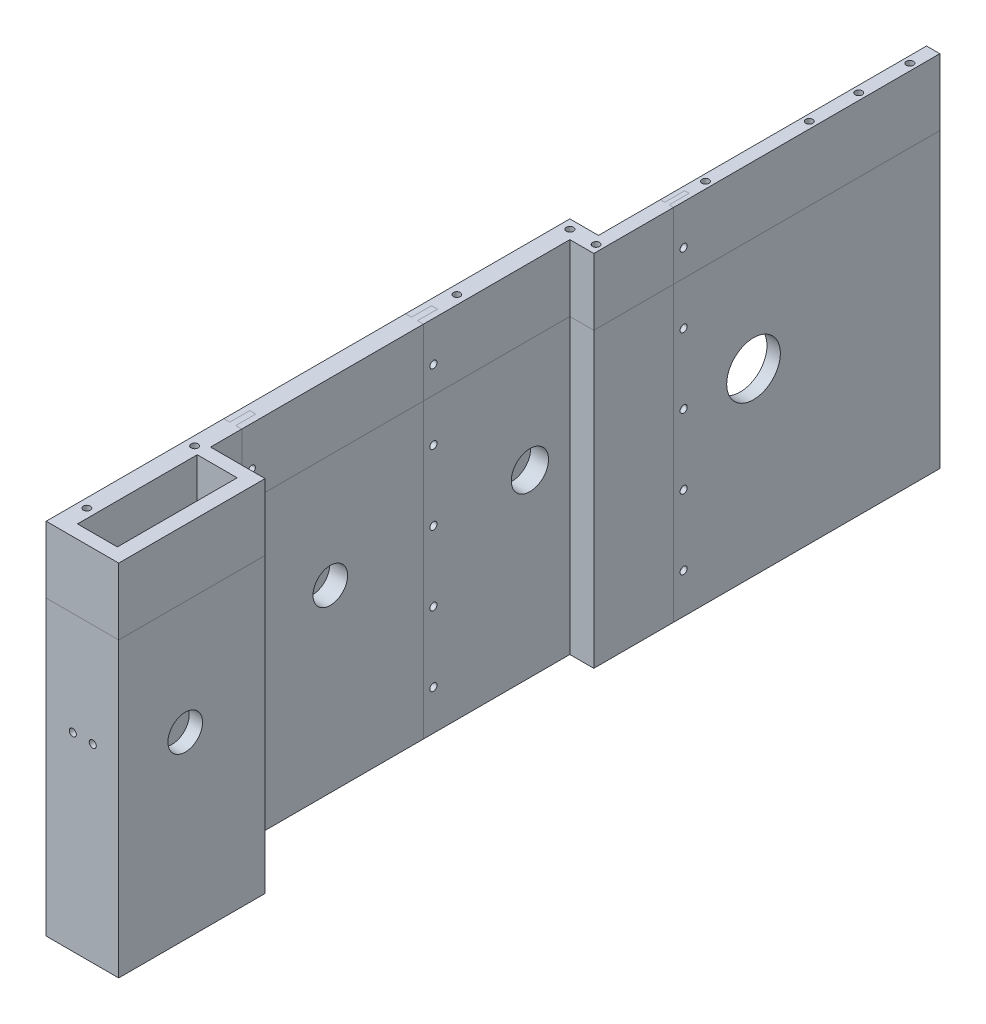
from build123d import *

# Parameters (mm, degrees)
SKETCH1_W               = 640
SKETCH1_H               = 270
SKETCH1_R               = 13
SKETCH1_R_2             = 14
SKETCH1_R_3             = 20.15
BOSS_EXTRUDE1_DEPTH     = 10
SKETCH2_W               = 440
SKETCH2_H               = 270
SKETCH2_R               = 14
SKETCH2_R_2             = 13
BOSS_EXTRUDE2_DEPTH     = 20
SKETCH3_W               = 430
SKETCH3_H               = 270
SKETCH3_R               = 5
SKETCH3_R_2             = 6
CUT_EXTRUDE1_DEPTH      = 20
SKETCH4_W               = 110
SKETCH4_H               = 270
SKETCH4_R               = 5
BOSS_EXTRUDE3_DEPTH     = 40
SKETCH6_W               = 100
SKETCH6_H               = 270
SKETCH6_R               = 5
CUT_EXTRUDE2_DEPTH      = 40
CUT_EXTRUDE3_DEPTH      = 351.89172119
CUT_EXTRUDE3_DEPTH_BACK = 351.89172119
SKETCH10_R              = 13
SKETCH11_W              = 40
SKETCH11_H              = 100
BOSS_EXTRUDE4_DEPTH     = 270
CUT_EXTRUDE4_DEPTH      = 420.761837236
CUT_EXTRUDE4_DEPTH_BACK = 420.761837236
SKETCH12_W              = 30
SKETCH12_H              = 90
SKETCH13_R              = 15
BOSS_EXTRUDE5_DEPTH     = 31
BOSS_EXTRUDE6_START     = 1
SKETCH15_W              = 110
SKETCH15_H              = 270
SKETCH15_R              = 13
BOSS_EXTRUDE6_DEPTH     = 1
SKETCH16_W              = 120
SKETCH16_H              = 270
SKETCH16_R              = 14
SKETCH16_W_2            = 320
SKETCH16_R_2            = 13
BOSS_EXTRUDE7_DEPTH     = 3.5
SKETCH17_W              = 200
SKETCH17_H              = 270
SKETCH17_R              = 20.15
BOSS_EXTRUDE8_DEPTH     = 2
SKETCH18_W              = 20
SKETCH18_H              = 270
BOSS_EXTRUDE9_DEPTH     = 5
BOSS_EXTRUDE10_DEPTH    = 270
CUT_EXTRUDE5_DEPTH      = 421.02648726
CUT_EXTRUDE5_DEPTH_BACK = 421.02648726
SKETCH20_W              = 2
SKETCH20_H              = 215
SKETCH20_W_2            = 21.5
SKETCH20_H_2            = 46.5
CUT_EXTRUDE7_DEPTH      = 349.73664849
CUT_EXTRUDE7_DEPTH_BACK = 349.73664849
SKETCH22_R              = 2.7
SPLIT5_START            = -33.5
SPLIT5_OUTLINE_W        = 270
SPLIT5_OUTLINE_H        = 121.51543622
SPLIT5_OUTLINE_R        = 13
SPLIT5_DEPTH            = 13.5
SPLIT5_2_OUTLINE_W      = 270
SPLIT5_2_OUTLINE_H      = 15
SPLIT5_2_OUTLINE_R      = 2.7
SPLIT5_2_DEPTH          = 4.5
SPLIT5_START_2          = -29
SPLIT5_3_OUTLINE_W      = 270
SPLIT5_3_OUTLINE_H      = 15
SPLIT5_3_OUTLINE_R      = 2.7
SPLIT5_3_DEPTH          = 4.5
SPLIT5_START_3          = -24.5
SPLIT5_4_OUTLINE_W      = 270
SPLIT5_4_OUTLINE_H      = 15
SPLIT5_4_OUTLINE_R      = 2.7
SPLIT5_4_DEPTH          = 4.5
SPLIT5_5_OUTLINE_W      = 270
SPLIT5_5_OUTLINE_H      = 108.5
SPLIT5_5_OUTLINE_R      = 14
SPLIT5_5_DEPTH          = 13.5
SPLIT5_START_4          = -12
SPLIT5_6_OUTLINE_W      = 270
SPLIT5_6_OUTLINE_H      = 60
SPLIT5_6_DEPTH          = 10
SPLIT5_START_5          = -20
SPLIT5_7_OUTLINE_W      = 270
SPLIT5_7_OUTLINE_H      = 13.5
SPLIT5_7_DEPTH          = 8
SPLIT5_8_OUTLINE_W      = 270
SPLIT5_8_OUTLINE_H      = 15
SPLIT5_8_OUTLINE_R      = 2.7
SPLIT5_8_DEPTH          = 4.5
SPLIT5_9_OUTLINE_W      = 270
SPLIT5_9_OUTLINE_H      = 15
SPLIT5_9_OUTLINE_R      = 2.7
SPLIT5_9_DEPTH          = 4.5
SPLIT5_START_6          = -8.67
SPLIT5_10_OUTLINE_W     = 270
SPLIT5_10_OUTLINE_H     = 15
SPLIT5_10_OUTLINE_R     = 2.7
SPLIT5_10_DEPTH         = 3.34
SPLIT5_11_OUTLINE_W     = 270
SPLIT5_11_OUTLINE_H     = 491.51543622
SPLIT5_11_OUTLINE_R     = 2.7
SPLIT5_11_OUTLINE_R_2   = 14
SPLIT5_11_OUTLINE_R_3   = 13
SPLIT5_11_OUTLINE_R_4   = 20.15
SPLIT5_11_DEPTH         = 31.5
SPLIT5_12_OUTLINE_W     = 270
SPLIT5_12_OUTLINE_H     = 15
SPLIT5_12_OUTLINE_R     = 2.7
SPLIT5_12_DEPTH         = 4.5
SPLIT5_13_OUTLINE_W     = 270
SPLIT5_13_OUTLINE_H     = 15
SPLIT5_13_OUTLINE_R     = 2.7
SPLIT5_13_DEPTH         = 4.5
SPLIT5_14_OUTLINE_W     = 270
SPLIT5_14_OUTLINE_H     = 185
SPLIT5_14_OUTLINE_R     = 20.15
SPLIT5_14_DEPTH         = 10
SPLIT5_15_OUTLINE_W     = 270
SPLIT5_15_OUTLINE_H     = 15
SPLIT5_15_OUTLINE_R     = 2.7
SPLIT5_15_DEPTH         = 3.33
SPLIT5_START_7          = -5.33
SPLIT5_16_OUTLINE_W     = 270
SPLIT5_16_OUTLINE_H     = 15
SPLIT5_16_OUTLINE_R     = 2.7
SPLIT5_16_DEPTH         = 3.33
CUT_EXTRUDE8_DEPTH      = 421.02648726
CUT_EXTRUDE8_DEPTH_BACK = 100
SKETCH28_R              = 2.65
SPLIT6_START            = 85
SPLIT6_OUTLINE_R        = 2.65
SPLIT6_DEPTH            = 50
SPLIT6_2_OUTLINE_R      = 2.65
SPLIT6_2_OUTLINE_W      = 30
SPLIT6_2_OUTLINE_H      = 90
SPLIT6_2_DEPTH          = 50
SPLIT6_START_2          = -30
SPLIT6_3_OUTLINE_R      = 2.7
SPLIT6_3_DEPTH          = 6
SPLIT6_4_DEPTH          = 50
SPLIT6_5_OUTLINE_R      = 2.65
SPLIT6_5_DEPTH          = 50
SPLIT6_START_3          = -33.5
SPLIT6_6_OUTLINE_W      = 50
SPLIT6_6_OUTLINE_H      = 121.51543622
SPLIT6_6_DEPTH          = 13.5
SPLIT6_7_OUTLINE_W      = 50
SPLIT6_7_OUTLINE_H      = 15
SPLIT6_7_OUTLINE_R      = 2.7
SPLIT6_7_DEPTH          = 4.5
SPLIT6_START_4          = -29
SPLIT6_8_OUTLINE_W      = 50
SPLIT6_8_OUTLINE_H      = 15
SPLIT6_8_OUTLINE_R      = 2.7
SPLIT6_8_DEPTH          = 4.5
SPLIT6_START_5          = -24.5
SPLIT6_9_OUTLINE_W      = 50
SPLIT6_9_OUTLINE_H      = 15
SPLIT6_9_OUTLINE_R      = 2.7
SPLIT6_9_DEPTH          = 4.5
SPLIT6_10_OUTLINE_W     = 50
SPLIT6_10_OUTLINE_H     = 108.5
SPLIT6_10_DEPTH         = 13.5
SPLIT6_START_6          = -12
SPLIT6_11_OUTLINE_W     = 50
SPLIT6_11_OUTLINE_H     = 60
SPLIT6_11_DEPTH         = 10
SPLIT6_START_7          = -20
SPLIT6_12_OUTLINE_W     = 50
SPLIT6_12_OUTLINE_H     = 13.5
SPLIT6_12_DEPTH         = 8
SPLIT6_13_OUTLINE_W     = 50
SPLIT6_13_OUTLINE_H     = 15
SPLIT6_13_OUTLINE_R     = 2.7
SPLIT6_13_DEPTH         = 4.5
SPLIT6_14_OUTLINE_W     = 50
SPLIT6_14_OUTLINE_H     = 15
SPLIT6_14_OUTLINE_R     = 2.7
SPLIT6_14_DEPTH         = 4.5
SPLIT6_START_8          = -8.67
SPLIT6_15_OUTLINE_W     = 50
SPLIT6_15_OUTLINE_H     = 15
SPLIT6_15_OUTLINE_R     = 2.7
SPLIT6_15_DEPTH         = 3.34
SPLIT6_START_9          = 84
SPLIT6_16_OUTLINE_R     = 2.65
SPLIT6_16_DEPTH         = 52
SPLIT6_17_OUTLINE_R     = 2.65
SPLIT6_17_OUTLINE_W     = 30
SPLIT6_17_OUTLINE_H     = 90
SPLIT6_17_DEPTH         = 50
SPLIT6_18_OUTLINE_R     = 2.65
SPLIT6_18_DEPTH         = 50
SPLIT6_START_10         = -13
SPLIT6_19_OUTLINE_R     = 2.7
SPLIT6_19_DEPTH         = 12
SKETCH31_R              = 2.65
CUT_EXTRUDE9_DEPTH      = 20
SKETCH34_R              = 27.5
BOSS_EXTRUDE14_DEPTH    = 10
SKETCH35_R              = 25
BOSS_EXTRUDE15_DEPTH    = 10


with BuildPart() as part:
    # Sketch1 → Boss-Extrude1 (new body)
    with BuildSketch(Plane(origin=(0, 0, 0), x_dir=(0, 0, -1), z_dir=(1, 0, 0))):
        Rectangle(SKETCH1_W, SKETCH1_H)
        with Locations((-270, 0)):
            Circle(SKETCH1_R, mode=Mode.SUBTRACT)
        with Locations((-120, 0)):
            Circle(SKETCH1_R, mode=Mode.SUBTRACT)
        with Locations((30, 0)):
            Circle(SKETCH1_R_2, mode=Mode.SUBTRACT)
        with Locations((180, 0)):
            Circle(SKETCH1_R_3, mode=Mode.SUBTRACT)
    extrude(amount=-BOSS_EXTRUDE1_DEPTH)

    # Sketch2 → Boss-Extrude2 (add)
    with BuildSketch(Plane.ZY.offset(10)):
        with Locations((100, 0)):
            Rectangle(SKETCH2_W, SKETCH2_H)
        with Locations(Location((-30, 0, 0), (0, 0, 180))):
            Circle(SKETCH2_R, mode=Mode.SUBTRACT)
        with Locations(Location((120, 0, 0), (0, 0, 180))):
            Circle(SKETCH2_R_2, mode=Mode.SUBTRACT)
        with Locations(Location((270, 0, 0), (0, 0, 180))):
            Circle(SKETCH2_R_2, mode=Mode.SUBTRACT)
    extrude(amount=BOSS_EXTRUDE2_DEPTH)

    # Sketch3 → Cut-Extrude1 (cut)
    with BuildSketch(Plane(origin=(0, 0, 0), x_dir=(0, 0, -1), z_dir=(1, 0, 0))):
        with Locations((-105, 0)):
            Rectangle(SKETCH3_W, SKETCH3_H)
        with Locations((-270, 0)):
            Circle(SKETCH3_R, mode=Mode.SUBTRACT)
        with Locations((-120, 0)):
            Circle(SKETCH3_R, mode=Mode.SUBTRACT)
        with Locations((30, 0)):
            Circle(SKETCH3_R_2, mode=Mode.SUBTRACT)
    extrude(amount=-CUT_EXTRUDE1_DEPTH, mode=Mode.SUBTRACT)

    # Sketch4 → Boss-Extrude3 (add)
    with BuildSketch(Plane(origin=(-20, 0, 0), x_dir=(0, 0, -1), z_dir=(1, 0, 0))):
        with Locations((-265, 0)):
            Rectangle(SKETCH4_W, SKETCH4_H)
        with Locations((-270, 0)):
            Circle(SKETCH4_R, mode=Mode.SUBTRACT)
    extrude(amount=BOSS_EXTRUDE3_DEPTH)

    # Sketch6 → Cut-Extrude2 (cut)
    with BuildSketch(Plane.ZY.offset(30)):
        with Locations((270, 0)):
            Rectangle(SKETCH6_W, SKETCH6_H)
        with Locations((270, 0)):
            Circle(SKETCH6_R, mode=Mode.SUBTRACT)
    extrude(amount=-CUT_EXTRUDE2_DEPTH, mode=Mode.SUBTRACT)


with BuildPart() as body_2:
    # Split2: read off the stored shape, not the designer's step
    # Split2: the piece on the far side of the plane
    add(part.part)
    split(bisect_by=Plane.XY, keep=Keep.BOTTOM)


with BuildPart() as part_1:
    add(part.part)

    # Split2
    split(bisect_by=Plane.XY, keep=Keep.TOP)

    # Sketch10 → Cut-Extrude3 (cut, two sides: drawn at the far end of the back side and taken through both)
    with BuildSketch(Plane(origin=(20, 0, 0), x_dir=(0, 0, -1), z_dir=(1, 0, 0)).offset(-CUT_EXTRUDE3_DEPTH_BACK)):
        with Locations((-270, 0)):
            Circle(SKETCH10_R)
    extrude(amount=CUT_EXTRUDE3_DEPTH + CUT_EXTRUDE3_DEPTH_BACK, mode=Mode.SUBTRACT)

    # Sketch11 → Boss-Extrude4 (add)
    with BuildSketch(Plane(origin=(0, 135, 0), x_dir=(1, 0, 0), z_dir=(0, 1, 0))):
        with Locations((-10, -270)):
            Rectangle(SKETCH11_W, SKETCH11_H)
    extrude(amount=-BOSS_EXTRUDE4_DEPTH)

    # Sketch12 → Cut-Extrude4 (cut, two sides: drawn at the far end of the back side and taken through both)
    with BuildSketch(Plane(origin=(0, 135, 0), x_dir=(1, 0, 0), z_dir=(0, 1, 0)).offset(-CUT_EXTRUDE4_DEPTH_BACK)):
        with Locations((-5, -265)):
            Rectangle(SKETCH12_W, SKETCH12_H)
    extrude(amount=CUT_EXTRUDE4_DEPTH + CUT_EXTRUDE4_DEPTH_BACK, mode=Mode.SUBTRACT)

    # Sketch13 → Boss-Extrude5 (add)
    with BuildSketch(Plane(origin=(-20, 0, 0), x_dir=(0, 0, -1), z_dir=(1, 0, 0))):
        with Locations(Location((-270, 0, 0), (0, 0, 180))):
            Circle(SKETCH13_R)
    extrude(amount=BOSS_EXTRUDE5_DEPTH)

    # Sketch15 → Boss-Extrude6 (add)
    with BuildSketch(Plane(origin=(20, 0, 0), x_dir=(0, 0, -1), z_dir=(1, 0, 0)).offset(BOSS_EXTRUDE6_START)):
        with Locations((-265, 0)):
            Rectangle(SKETCH15_W, SKETCH15_H)
        with Locations((-270, 0)):
            Circle(SKETCH15_R, mode=Mode.SUBTRACT)
    extrude(amount=-BOSS_EXTRUDE6_DEPTH)

    add(body_2.part)  # Boss-Extrude7 merges body 2
    # Sketch16 → Boss-Extrude7 (add)
    # profile 1 of 2: a face of its own
    with BuildSketch(Plane.ZY.offset(30)):
        with Locations((-60, 0)):
            Rectangle(SKETCH16_W, SKETCH16_H)
        with Locations(Location((-30, 0, 0), (0, 0, 180))):
            Circle(SKETCH16_R, mode=Mode.SUBTRACT)
    # profile 2 of 2: a face of its own
    with BuildSketch(Plane.ZY.offset(30)):
        with Locations((160, 0)):
            Rectangle(SKETCH16_W_2, SKETCH16_H)
        with Locations(Location((120, 0, 0), (0, 0, 180))):
            Circle(SKETCH16_R_2, mode=Mode.SUBTRACT)
    extrude(amount=BOSS_EXTRUDE7_DEPTH)

    # Sketch17 → Boss-Extrude8 (add)
    with BuildSketch(Plane.ZY.offset(10)):
        with Locations((-220, 0)):
            Rectangle(SKETCH17_W, SKETCH17_H)
        with Locations(Location((-180, 0, 0), (0, 0, 180))):
            Circle(SKETCH17_R, mode=Mode.SUBTRACT)
    extrude(amount=BOSS_EXTRUDE8_DEPTH)

    # Sketch18 → Boss-Extrude9 (add)
    with BuildSketch(Plane.XY.offset(-110)):
        with Locations((-10, 0)):
            Rectangle(SKETCH18_W, SKETCH18_H)
    extrude(amount=BOSS_EXTRUDE9_DEPTH)

    # Sketch19 → Boss-Extrude10 (add)
    with BuildSketch(Plane(origin=(0, 135, 0), x_dir=(1, 0, 0), z_dir=(0, 1, 0))):
        Polygon((-12, 73.5), (-33.5, 73.5), (-33.5, 60), (-2, 60), (-2, 120), (-12, 120), align=None)
    extrude(amount=-BOSS_EXTRUDE10_DEPTH)

    # Sketch20 → Cut-Extrude5 (cut, two sides: drawn at the far end of the back side and taken through both)
    with BuildSketch(Plane(origin=(0, 135, 0), x_dir=(1, 0, 0), z_dir=(0, 1, 0)).offset(-CUT_EXTRUDE5_DEPTH_BACK)):
        with Locations((-1, 212.5)):
            Rectangle(SKETCH20_W, SKETCH20_H)
        with Locations((-22.75, 96.75)):
            Rectangle(SKETCH20_W_2, SKETCH20_H_2)
    extrude(amount=CUT_EXTRUDE5_DEPTH + CUT_EXTRUDE5_DEPTH_BACK, mode=Mode.SUBTRACT)

    # Sketch22 → Cut-Extrude7 (cut, two sides: drawn at the far end of the back side and taken through both)
    with BuildSketch(Plane(origin=(-2, 0, 0), x_dir=(0, 0, -1), z_dir=(1, 0, 0)).offset(-CUT_EXTRUDE7_DEPTH_BACK)):
        with Locations((127.5, 105)):
            Circle(SKETCH22_R)
        with Locations((127.5, 52.5)):
            Circle(SKETCH22_R)
        with Locations((127.5, 0)):
            Circle(SKETCH22_R)
        with Locations((127.5, -52.5)):
            Circle(SKETCH22_R)
        with Locations((127.5, -105)):
            Circle(SKETCH22_R)
        with Locations((-42.5, -105)):
            Circle(SKETCH22_R)
        with Locations((-42.5, -52.5)):
            Circle(SKETCH22_R)
        with Locations((-42.5, 0)):
            Circle(SKETCH22_R)
        with Locations((-42.5, 52.5)):
            Circle(SKETCH22_R)
        with Locations((-42.5, 105)):
            Circle(SKETCH22_R)
        with Locations((-179.01543622, -105)):
            Circle(SKETCH22_R)
        with Locations((-179.01543622, -52.5)):
            Circle(SKETCH22_R)
        with Locations((-179.01543622, 0)):
            Circle(SKETCH22_R)
        with Locations((-179.01543622, 52.5)):
            Circle(SKETCH22_R)
        with Locations((-179.01543622, 105)):
            Circle(SKETCH22_R)
    extrude(amount=CUT_EXTRUDE7_DEPTH + CUT_EXTRUDE7_DEPTH_BACK, mode=Mode.SUBTRACT)

    # Split5 11 outline → Split5 11 (cut)
    with BuildSketch(Plane.YZ.offset(SPLIT5_START)):
        with Locations((0, -74.24228189)):
            Rectangle(SPLIT5_11_OUTLINE_W, SPLIT5_11_OUTLINE_H)
        with Locations((-105, 42.5)):
            Circle(SPLIT5_11_OUTLINE_R, mode=Mode.SUBTRACT)
        with Locations((-52.5, 42.5)):
            Circle(SPLIT5_11_OUTLINE_R, mode=Mode.SUBTRACT)
        with Locations((0, -30)):
            Circle(SPLIT5_11_OUTLINE_R_2, mode=Mode.SUBTRACT)
        with Locations((0, 42.5)):
            Circle(SPLIT5_11_OUTLINE_R, mode=Mode.SUBTRACT)
        with Locations((52.5, 42.5)):
            Circle(SPLIT5_11_OUTLINE_R, mode=Mode.SUBTRACT)
        with Locations((105, 42.5)):
            Circle(SPLIT5_11_OUTLINE_R, mode=Mode.SUBTRACT)
        with Locations((0, 120)):
            Circle(SPLIT5_11_OUTLINE_R_3, mode=Mode.SUBTRACT)
        with Locations((105, -127.5)):
            Circle(SPLIT5_11_OUTLINE_R, mode=Mode.SUBTRACT)
        with Locations((-105, -127.5)):
            Circle(SPLIT5_11_OUTLINE_R, mode=Mode.SUBTRACT)
        with Locations((-52.5, -127.5)):
            Circle(SPLIT5_11_OUTLINE_R, mode=Mode.SUBTRACT)
        with Locations((0, -180)):
            Circle(SPLIT5_11_OUTLINE_R_4, mode=Mode.SUBTRACT)
        with Locations((0, -127.5)):
            Circle(SPLIT5_11_OUTLINE_R, mode=Mode.SUBTRACT)
        with Locations((52.5, -127.5)):
            Circle(SPLIT5_11_OUTLINE_R, mode=Mode.SUBTRACT)
    extrude(amount=SPLIT5_11_DEPTH, mode=Mode.SUBTRACT)

    # Split5 12 outline → Split5 12 (cut)
    with BuildSketch(Plane.YZ.offset(SPLIT5_START)):
        with Locations((0, 179.01543622)):
            Rectangle(SPLIT5_12_OUTLINE_W, SPLIT5_12_OUTLINE_H)
        with Locations((-105, 179.01543622)):
            Circle(SPLIT5_12_OUTLINE_R, mode=Mode.SUBTRACT)
        with Locations((-52.5, 179.01543622)):
            Circle(SPLIT5_12_OUTLINE_R, mode=Mode.SUBTRACT)
        with Locations((0, 179.01543622)):
            Circle(SPLIT5_12_OUTLINE_R, mode=Mode.SUBTRACT)
        with Locations((52.5, 179.01543622)):
            Circle(SPLIT5_12_OUTLINE_R, mode=Mode.SUBTRACT)
        with Locations((105, 179.01543622)):
            Circle(SPLIT5_12_OUTLINE_R, mode=Mode.SUBTRACT)
    extrude(amount=SPLIT5_12_DEPTH, mode=Mode.SUBTRACT)

    # Split5 13 outline → Split5 13 (cut)
    with BuildSketch(Plane.YZ.offset(SPLIT5_START_3)):
        with Locations((0, 179.01543622)):
            Rectangle(SPLIT5_13_OUTLINE_W, SPLIT5_13_OUTLINE_H)
        with Locations((-105, 179.01543622)):
            Circle(SPLIT5_13_OUTLINE_R, mode=Mode.SUBTRACT)
        with Locations((-52.5, 179.01543622)):
            Circle(SPLIT5_13_OUTLINE_R, mode=Mode.SUBTRACT)
        with Locations((0, 179.01543622)):
            Circle(SPLIT5_13_OUTLINE_R, mode=Mode.SUBTRACT)
        with Locations((52.5, 179.01543622)):
            Circle(SPLIT5_13_OUTLINE_R, mode=Mode.SUBTRACT)
        with Locations((105, 179.01543622)):
            Circle(SPLIT5_13_OUTLINE_R, mode=Mode.SUBTRACT)
    extrude(amount=SPLIT5_13_DEPTH, mode=Mode.SUBTRACT)


with BuildPart() as body_2_2:
    # Split5: read off the stored shape, not the designer's step
    # Split5 outline → Split5 (new body)
    with BuildSketch(Plane.YZ.offset(SPLIT5_START)):
        with Locations((0, 110.75771811)):
            Rectangle(SPLIT5_OUTLINE_W, SPLIT5_OUTLINE_H)
        with Locations((0, 120)):
            Circle(SPLIT5_OUTLINE_R, mode=Mode.SUBTRACT)
    extrude(amount=SPLIT5_DEPTH)

    # Split5 2 outline → Split5 2 (add)
    with BuildSketch(Plane.YZ.offset(SPLIT5_START)):
        with Locations((0, 179.01543622)):
            Rectangle(SPLIT5_2_OUTLINE_W, SPLIT5_2_OUTLINE_H)
        with Locations((-105, 179.01543622)):
            Circle(SPLIT5_2_OUTLINE_R, mode=Mode.SUBTRACT)
        with Locations((-52.5, 179.01543622)):
            Circle(SPLIT5_2_OUTLINE_R, mode=Mode.SUBTRACT)
        with Locations((0, 179.01543622)):
            Circle(SPLIT5_2_OUTLINE_R, mode=Mode.SUBTRACT)
        with Locations((52.5, 179.01543622)):
            Circle(SPLIT5_2_OUTLINE_R, mode=Mode.SUBTRACT)
        with Locations((105, 179.01543622)):
            Circle(SPLIT5_2_OUTLINE_R, mode=Mode.SUBTRACT)
    extrude(amount=SPLIT5_2_DEPTH)

    # Split5 3 outline → Split5 3 (add)
    with BuildSketch(Plane.YZ.offset(SPLIT5_START_2)):
        with Locations((0, 42.5)):
            Rectangle(SPLIT5_3_OUTLINE_W, SPLIT5_3_OUTLINE_H)
        with Locations((-105, 42.5)):
            Circle(SPLIT5_3_OUTLINE_R, mode=Mode.SUBTRACT)
        with Locations((-52.5, 42.5)):
            Circle(SPLIT5_3_OUTLINE_R, mode=Mode.SUBTRACT)
        with Locations((0, 42.5)):
            Circle(SPLIT5_3_OUTLINE_R, mode=Mode.SUBTRACT)
        with Locations((52.5, 42.5)):
            Circle(SPLIT5_3_OUTLINE_R, mode=Mode.SUBTRACT)
        with Locations((105, 42.5)):
            Circle(SPLIT5_3_OUTLINE_R, mode=Mode.SUBTRACT)
    extrude(amount=SPLIT5_3_DEPTH)

    # Split5 4 outline → Split5 4 (add)
    with BuildSketch(Plane.YZ.offset(SPLIT5_START_3)):
        with Locations((0, 179.01543622)):
            Rectangle(SPLIT5_4_OUTLINE_W, SPLIT5_4_OUTLINE_H)
        with Locations((-105, 179.01543622)):
            Circle(SPLIT5_4_OUTLINE_R, mode=Mode.SUBTRACT)
        with Locations((-52.5, 179.01543622)):
            Circle(SPLIT5_4_OUTLINE_R, mode=Mode.SUBTRACT)
        with Locations((0, 179.01543622)):
            Circle(SPLIT5_4_OUTLINE_R, mode=Mode.SUBTRACT)
        with Locations((52.5, 179.01543622)):
            Circle(SPLIT5_4_OUTLINE_R, mode=Mode.SUBTRACT)
        with Locations((105, 179.01543622)):
            Circle(SPLIT5_4_OUTLINE_R, mode=Mode.SUBTRACT)
    extrude(amount=SPLIT5_4_DEPTH)

    # Split6 4 outline → Split6 4 (cut)
    with BuildSketch(Plane(origin=(0, 0, 0), x_dir=(1, 0, 0), z_dir=(0, 1, 0)).offset(SPLIT6_START)):
        Polygon((-29, -35), (-29, -50), (-33.5, -50), (-33.5, -186.51543622), (-29, -186.51543622), (-29, -171.51543622), (-24.5, -171.51543622), (-24.5, -186.51543622), (-20, -186.51543622), (-20, -50), (-24.5, -50), (-24.5, -35), align=None)
    extrude(amount=SPLIT6_4_DEPTH, mode=Mode.SUBTRACT)

    # Sketch35 → Boss-Extrude15 (add)
    with BuildSketch(Plane.ZY.offset(33.5)):
        with Locations((120, 0)):
            Circle(SKETCH35_R)
    extrude(amount=BOSS_EXTRUDE15_DEPTH)


with BuildPart() as body_3:
    # Split5 5 outline → Split5 5 (new body)
    with BuildSketch(Plane.YZ.offset(SPLIT5_START)):
        with Locations((0, -19.25)):
            Rectangle(SPLIT5_5_OUTLINE_W, SPLIT5_5_OUTLINE_H)
        with Locations((0, -30)):
            Circle(SPLIT5_5_OUTLINE_R, mode=Mode.SUBTRACT)
    extrude(amount=SPLIT5_5_DEPTH)

    # Split5 6 outline → Split5 6 (add)
    with BuildSketch(Plane.YZ.offset(SPLIT5_START_4)):
        with Locations((0, -90)):
            Rectangle(SPLIT5_6_OUTLINE_W, SPLIT5_6_OUTLINE_H)
    extrude(amount=SPLIT5_6_DEPTH)

    # Split5 7 outline → Split5 7 (add)
    with BuildSketch(Plane.YZ.offset(SPLIT5_START_5)):
        with Locations((0, -66.75)):
            Rectangle(SPLIT5_7_OUTLINE_W, SPLIT5_7_OUTLINE_H)
    extrude(amount=SPLIT5_7_DEPTH)

    # Split5 8 outline → Split5 8 (add)
    with BuildSketch(Plane.YZ.offset(SPLIT5_START)):
        with Locations((0, 42.5)):
            Rectangle(SPLIT5_8_OUTLINE_W, SPLIT5_8_OUTLINE_H)
        with Locations((-105, 42.5)):
            Circle(SPLIT5_8_OUTLINE_R, mode=Mode.SUBTRACT)
        with Locations((-52.5, 42.5)):
            Circle(SPLIT5_8_OUTLINE_R, mode=Mode.SUBTRACT)
        with Locations((0, 42.5)):
            Circle(SPLIT5_8_OUTLINE_R, mode=Mode.SUBTRACT)
        with Locations((52.5, 42.5)):
            Circle(SPLIT5_8_OUTLINE_R, mode=Mode.SUBTRACT)
        with Locations((105, 42.5)):
            Circle(SPLIT5_8_OUTLINE_R, mode=Mode.SUBTRACT)
    extrude(amount=SPLIT5_8_DEPTH)

    # Split5 9 outline → Split5 9 (add)
    with BuildSketch(Plane.YZ.offset(SPLIT5_START_3)):
        with Locations((0, 42.5)):
            Rectangle(SPLIT5_9_OUTLINE_W, SPLIT5_9_OUTLINE_H)
        with Locations((-105, 42.5)):
            Circle(SPLIT5_9_OUTLINE_R, mode=Mode.SUBTRACT)
        with Locations((-52.5, 42.5)):
            Circle(SPLIT5_9_OUTLINE_R, mode=Mode.SUBTRACT)
        with Locations((0, 42.5)):
            Circle(SPLIT5_9_OUTLINE_R, mode=Mode.SUBTRACT)
        with Locations((52.5, 42.5)):
            Circle(SPLIT5_9_OUTLINE_R, mode=Mode.SUBTRACT)
        with Locations((105, 42.5)):
            Circle(SPLIT5_9_OUTLINE_R, mode=Mode.SUBTRACT)
    extrude(amount=SPLIT5_9_DEPTH)

    # Split5 10 outline → Split5 10 (add)
    with BuildSketch(Plane.YZ.offset(SPLIT5_START_6)):
        with Locations((0, -127.5)):
            Rectangle(SPLIT5_10_OUTLINE_W, SPLIT5_10_OUTLINE_H)
        with Locations((-105, -127.5)):
            Circle(SPLIT5_10_OUTLINE_R, mode=Mode.SUBTRACT)
        with Locations((-52.5, -127.5)):
            Circle(SPLIT5_10_OUTLINE_R, mode=Mode.SUBTRACT)
        with Locations((0, -127.5)):
            Circle(SPLIT5_10_OUTLINE_R, mode=Mode.SUBTRACT)
        with Locations((52.5, -127.5)):
            Circle(SPLIT5_10_OUTLINE_R, mode=Mode.SUBTRACT)
        with Locations((105, -127.5)):
            Circle(SPLIT5_10_OUTLINE_R, mode=Mode.SUBTRACT)
    extrude(amount=SPLIT5_10_DEPTH)


with BuildPart() as body_4:
    # Split5 14 outline → Split5 14 (new body)
    with BuildSketch(Plane.YZ.offset(SPLIT5_START_4)):
        with Locations((0, -227.5)):
            Rectangle(SPLIT5_14_OUTLINE_W, SPLIT5_14_OUTLINE_H)
        with Locations((0, -180)):
            Circle(SPLIT5_14_OUTLINE_R, mode=Mode.SUBTRACT)
    extrude(amount=SPLIT5_14_DEPTH)

    # Split5 15 outline → Split5 15 (add)
    with BuildSketch(Plane.YZ.offset(SPLIT5_START_4)):
        with Locations((0, -127.5)):
            Rectangle(SPLIT5_15_OUTLINE_W, SPLIT5_15_OUTLINE_H)
        with Locations((-105, -127.5)):
            Circle(SPLIT5_15_OUTLINE_R, mode=Mode.SUBTRACT)
        with Locations((-52.5, -127.5)):
            Circle(SPLIT5_15_OUTLINE_R, mode=Mode.SUBTRACT)
        with Locations((0, -127.5)):
            Circle(SPLIT5_15_OUTLINE_R, mode=Mode.SUBTRACT)
        with Locations((52.5, -127.5)):
            Circle(SPLIT5_15_OUTLINE_R, mode=Mode.SUBTRACT)
        with Locations((105, -127.5)):
            Circle(SPLIT5_15_OUTLINE_R, mode=Mode.SUBTRACT)
    extrude(amount=SPLIT5_15_DEPTH)

    # Split5 16 outline → Split5 16 (add)
    with BuildSketch(Plane.YZ.offset(SPLIT5_START_7)):
        with Locations((0, -127.5)):
            Rectangle(SPLIT5_16_OUTLINE_W, SPLIT5_16_OUTLINE_H)
        with Locations((-105, -127.5)):
            Circle(SPLIT5_16_OUTLINE_R, mode=Mode.SUBTRACT)
        with Locations((-52.5, -127.5)):
            Circle(SPLIT5_16_OUTLINE_R, mode=Mode.SUBTRACT)
        with Locations((0, -127.5)):
            Circle(SPLIT5_16_OUTLINE_R, mode=Mode.SUBTRACT)
        with Locations((52.5, -127.5)):
            Circle(SPLIT5_16_OUTLINE_R, mode=Mode.SUBTRACT)
        with Locations((105, -127.5)):
            Circle(SPLIT5_16_OUTLINE_R, mode=Mode.SUBTRACT)
    extrude(amount=SPLIT5_16_DEPTH)


with BuildPart() as cut_extrude8_tool:
    # Sketch28 → Cut-Extrude8 (new, two sides: drawn at the far end of the back side and taken through both)
    with BuildSketch(Plane(origin=(0, 135, 0), x_dir=(1, 0, 0), z_dir=(0, 1, 0)).offset(-CUT_EXTRUDE8_DEPTH_BACK)):
        with Locations(Location((-7, 264.039794869, 0), (0, 0, 90))):
            Circle(SKETCH28_R)
        with Locations(Location((-7, 66.75, 0), (0, 0, 90))):
            Circle(SKETCH28_R)
        with Locations(Location((-26.75, 66.75, 0), (0, 0, 90))):
            Circle(SKETCH28_R)
        with Locations(Location((-26.75, -215.213559873, 0), (0, 0, 90))):
            Circle(SKETCH28_R)
        with Locations(Location((-26.75, -296.200419439, 0), (0, 0, 90))):
            Circle(SKETCH28_R)
        with Locations(Location((-26.75, -18.22288629, 0), (0, 0, 90))):
            Circle(SKETCH28_R)
        with Locations(Location((-7, 148.921229797, 0), (0, 0, 90))):
            Circle(SKETCH28_R)
        with Locations(Location((-7, 226.927669372, 0), (0, 0, 90))):
            Circle(SKETCH28_R)
        with Locations(Location((-7, 302.490809514, 0), (0, 0, 90))):
            Circle(SKETCH28_R)
    extrude(amount=CUT_EXTRUDE8_DEPTH + CUT_EXTRUDE8_DEPTH_BACK)


with BuildPart() as part_2:
    add(part_1.part)

    # Cut-Extrude8: cut by cut_extrude8_tool
    add(cut_extrude8_tool.part, mode=Mode.SUBTRACT)

    # Split6 17 outline → Split6 17 (cut)
    with BuildSketch(Plane(origin=(0, 0, 0), x_dir=(1, 0, 0), z_dir=(0, 1, 0)).offset(SPLIT6_START)):
        Polygon((-29, -171.51543622), (-29, -186.51543622), (-33.5, -186.51543622), (-33.5, -320), (21, -320), (21, -210), (-20, -210), (-20, -186.51543622), (-24.5, -186.51543622), (-24.5, -171.51543622), align=None)
        with Locations((-26.75, -296.200419439)):
            Circle(SPLIT6_17_OUTLINE_R, mode=Mode.SUBTRACT)
        with Locations((-5, -265)):
            Rectangle(SPLIT6_17_OUTLINE_W, SPLIT6_17_OUTLINE_H, mode=Mode.SUBTRACT)
        with Locations((-26.75, -215.213559873)):
            Circle(SPLIT6_17_OUTLINE_R, mode=Mode.SUBTRACT)
    extrude(amount=SPLIT6_17_DEPTH, mode=Mode.SUBTRACT)

    # Sketch31 → Cut-Extrude9 (cut)
    with BuildSketch(Plane.XY.offset(320)):
        with Locations((-13.5, 7.5)):
            Circle(SKETCH31_R)
        with Locations((1.5, 7.5)):
            Circle(SKETCH31_R)
    extrude(amount=-CUT_EXTRUDE9_DEPTH, mode=Mode.SUBTRACT)


with BuildPart() as body_3_1:
    add(body_3.part)

    # Cut-Extrude8: cut by cut_extrude8_tool
    add(cut_extrude8_tool.part, mode=Mode.SUBTRACT)

    # Split6 5 outline → Split6 5 (cut)
    with BuildSketch(Plane(origin=(0, 0, 0), x_dir=(1, 0, 0), z_dir=(0, 1, 0)).offset(SPLIT6_START)):
        Polygon((-8.67, 135), (-8.67, 120), (-12, 120), (-12, 73.5), (-33.5, 73.5), (-33.5, -50), (-29, -50), (-29, -35), (-24.5, -35), (-24.5, -50), (-20, -50), (-20, 60), (-2, 60), (-2, 120), (-5.33, 120), (-5.33, 135), align=None)
        with Locations((-26.75, -18.22288629)):
            Circle(SPLIT6_5_OUTLINE_R, mode=Mode.SUBTRACT)
        with Locations((-26.75, 66.75)):
            Circle(SPLIT6_5_OUTLINE_R, mode=Mode.SUBTRACT)
        with Locations((-7, 66.75)):
            Circle(SPLIT6_5_OUTLINE_R, mode=Mode.SUBTRACT)
    extrude(amount=SPLIT6_5_DEPTH, mode=Mode.SUBTRACT)

    # Sketch34 → Boss-Extrude14 (add)
    with BuildSketch(Plane.ZY.offset(33.5)):
        with Locations((-30, 0)):
            Circle(SKETCH34_R)
    extrude(amount=BOSS_EXTRUDE14_DEPTH)


with BuildPart() as body_4_1:
    add(body_4.part)

    # Cut-Extrude8: cut by cut_extrude8_tool
    add(cut_extrude8_tool.part, mode=Mode.SUBTRACT)

    # Split6: read off the stored shape, not the designer's step
    # Split6 outline → Split6 (cut)
    with BuildSketch(Plane(origin=(0, 0, 0), x_dir=(1, 0, 0), z_dir=(0, 1, 0)).offset(SPLIT6_START)):
        Polygon((-12, 120), (-8.67, 120), (-8.67, 135), (-5.33, 135), (-5.33, 120), (-2, 120), (-2, 320), (-12, 320), align=None)
        with Locations((-7, 148.921229797)):
            Circle(SPLIT6_OUTLINE_R, mode=Mode.SUBTRACT)
        with Locations((-7, 226.927669372)):
            Circle(SPLIT6_OUTLINE_R, mode=Mode.SUBTRACT)
        with Locations((-7, 264.039794869)):
            Circle(SPLIT6_OUTLINE_R, mode=Mode.SUBTRACT)
        with Locations((-7, 302.490809514)):
            Circle(SPLIT6_OUTLINE_R, mode=Mode.SUBTRACT)
    extrude(amount=SPLIT6_DEPTH, mode=Mode.SUBTRACT)


with BuildPart() as body_5:
    # Split6 2 outline → Split6 2 (new body)
    with BuildSketch(Plane(origin=(0, 0, 0), x_dir=(1, 0, 0), z_dir=(0, 1, 0)).offset(SPLIT6_START)):
        Polygon((-29, -171.51543622), (-29, -186.51543622), (-33.5, -186.51543622), (-33.5, -320), (21, -320), (21, -210), (-20, -210), (-20, -186.51543622), (-24.5, -186.51543622), (-24.5, -171.51543622), align=None)
        with Locations((-26.75, -296.200419439)):
            Circle(SPLIT6_2_OUTLINE_R, mode=Mode.SUBTRACT)
        with Locations((-5, -265)):
            Rectangle(SPLIT6_2_OUTLINE_W, SPLIT6_2_OUTLINE_H, mode=Mode.SUBTRACT)
        with Locations((-26.75, -215.213559873)):
            Circle(SPLIT6_2_OUTLINE_R, mode=Mode.SUBTRACT)
    extrude(amount=SPLIT6_2_DEPTH)

    # Split6 3 outline → Split6 3 (cut)
    with BuildSketch(Plane.YZ.offset(SPLIT6_START_2)):
        with Locations((105, 179.01543622)):
            Circle(SPLIT6_3_OUTLINE_R)
    extrude(amount=SPLIT6_3_DEPTH, mode=Mode.SUBTRACT)


with BuildPart() as body_6:
    # Split6 6 outline → Split6 6 (new body)
    with BuildSketch(Plane.YZ.offset(SPLIT6_START_3)):
        with Locations((110, 110.75771811)):
            Rectangle(SPLIT6_6_OUTLINE_W, SPLIT6_6_OUTLINE_H)
    extrude(amount=SPLIT6_6_DEPTH)

    # Split6 7 outline → Split6 7 (add)
    with BuildSketch(Plane.YZ.offset(SPLIT6_START_3)):
        with Locations((110, 179.01543622)):
            Rectangle(SPLIT6_7_OUTLINE_W, SPLIT6_7_OUTLINE_H)
        with Locations((105, 179.01543622)):
            Circle(SPLIT6_7_OUTLINE_R, mode=Mode.SUBTRACT)
    extrude(amount=SPLIT6_7_DEPTH)

    # Split6 8 outline → Split6 8 (add)
    with BuildSketch(Plane.YZ.offset(SPLIT6_START_4)):
        with Locations((110, 42.5)):
            Rectangle(SPLIT6_8_OUTLINE_W, SPLIT6_8_OUTLINE_H)
        with Locations((105, 42.5)):
            Circle(SPLIT6_8_OUTLINE_R, mode=Mode.SUBTRACT)
    extrude(amount=SPLIT6_8_DEPTH)

    # Split6 9 outline → Split6 9 (add)
    with BuildSketch(Plane.YZ.offset(SPLIT6_START_5)):
        with Locations((110, 179.01543622)):
            Rectangle(SPLIT6_9_OUTLINE_W, SPLIT6_9_OUTLINE_H)
        with Locations((105, 179.01543622)):
            Circle(SPLIT6_9_OUTLINE_R, mode=Mode.SUBTRACT)
    extrude(amount=SPLIT6_9_DEPTH)


with BuildPart() as body_7:
    # Split6 10 outline → Split6 10 (new body)
    with BuildSketch(Plane.YZ.offset(SPLIT6_START_3)):
        with Locations((110, -19.25)):
            Rectangle(SPLIT6_10_OUTLINE_W, SPLIT6_10_OUTLINE_H)
    extrude(amount=SPLIT6_10_DEPTH)

    # Split6 11 outline → Split6 11 (add)
    with BuildSketch(Plane.YZ.offset(SPLIT6_START_6)):
        with Locations((110, -90)):
            Rectangle(SPLIT6_11_OUTLINE_W, SPLIT6_11_OUTLINE_H)
    extrude(amount=SPLIT6_11_DEPTH)

    # Split6 12 outline → Split6 12 (add)
    with BuildSketch(Plane.YZ.offset(SPLIT6_START_7)):
        with Locations((110, -66.75)):
            Rectangle(SPLIT6_12_OUTLINE_W, SPLIT6_12_OUTLINE_H)
    extrude(amount=SPLIT6_12_DEPTH)

    # Split6 13 outline → Split6 13 (add)
    with BuildSketch(Plane.YZ.offset(SPLIT6_START_3)):
        with Locations((110, 42.5)):
            Rectangle(SPLIT6_13_OUTLINE_W, SPLIT6_13_OUTLINE_H)
        with Locations((105, 42.5)):
            Circle(SPLIT6_13_OUTLINE_R, mode=Mode.SUBTRACT)
    extrude(amount=SPLIT6_13_DEPTH)

    # Split6 14 outline → Split6 14 (add)
    with BuildSketch(Plane.YZ.offset(SPLIT6_START_5)):
        with Locations((110, 42.5)):
            Rectangle(SPLIT6_14_OUTLINE_W, SPLIT6_14_OUTLINE_H)
        with Locations((105, 42.5)):
            Circle(SPLIT6_14_OUTLINE_R, mode=Mode.SUBTRACT)
    extrude(amount=SPLIT6_14_DEPTH)

    # Split6 15 outline → Split6 15 (add)
    with BuildSketch(Plane.YZ.offset(SPLIT6_START_8)):
        with Locations((110, -127.5)):
            Rectangle(SPLIT6_15_OUTLINE_W, SPLIT6_15_OUTLINE_H)
        with Locations((105, -127.5)):
            Circle(SPLIT6_15_OUTLINE_R, mode=Mode.SUBTRACT)
    extrude(amount=SPLIT6_15_DEPTH)

    # Split6 16 outline → Split6 16 (cut)
    with BuildSketch(Plane(origin=(0, 0, 0), x_dir=(1, 0, 0), z_dir=(0, 1, 0)).offset(SPLIT6_START_9)):
        with Locations((-7, 66.75)):
            Circle(SPLIT6_16_OUTLINE_R)
        with Locations((-26.75, 66.75)):
            Circle(SPLIT6_16_OUTLINE_R)
        with Locations((-26.75, -18.22288629)):
            Circle(SPLIT6_16_OUTLINE_R)
    extrude(amount=SPLIT6_16_DEPTH, mode=Mode.SUBTRACT)


with BuildPart() as body_8:
    # Split6 18 outline → Split6 18 (new body)
    with BuildSketch(Plane(origin=(0, 0, 0), x_dir=(1, 0, 0), z_dir=(0, 1, 0)).offset(SPLIT6_START)):
        Polygon((-8.67, 135), (-5.33, 135), (-5.33, 120), (-2, 120), (-2, 320), (-12, 320), (-12, 120), (-8.67, 120), align=None)
        with Locations((-7, 148.921229797)):
            Circle(SPLIT6_18_OUTLINE_R, mode=Mode.SUBTRACT)
        with Locations((-7, 226.927669372)):
            Circle(SPLIT6_18_OUTLINE_R, mode=Mode.SUBTRACT)
        with Locations((-7, 264.039794869)):
            Circle(SPLIT6_18_OUTLINE_R, mode=Mode.SUBTRACT)
        with Locations((-7, 302.490809514)):
            Circle(SPLIT6_18_OUTLINE_R, mode=Mode.SUBTRACT)
    extrude(amount=SPLIT6_18_DEPTH)

    # Split6 19 outline → Split6 19 (cut)
    with BuildSketch(Plane.YZ.offset(SPLIT6_START_10)):
        with Locations((105, -127.5)):
            Circle(SPLIT6_19_OUTLINE_R)
    extrude(amount=SPLIT6_19_DEPTH, mode=Mode.SUBTRACT)


solid = Compound([body_2_2.part, part_2.part, body_3_1.part, body_4_1.part, body_5.part, body_6.part, body_7.part, body_8.part])
